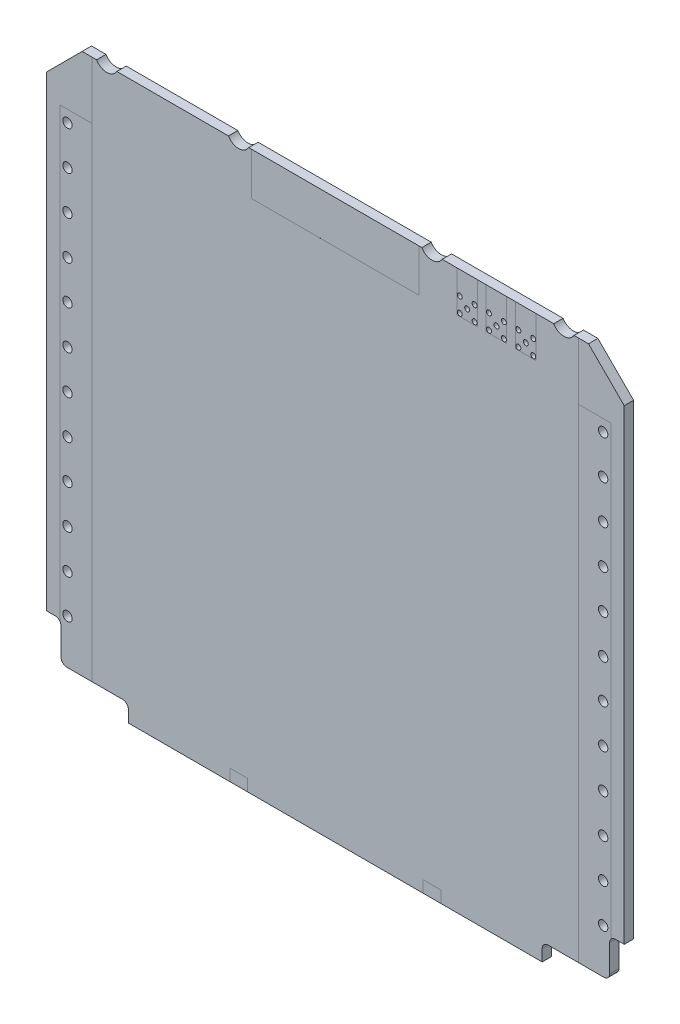
from build123d import *

# Parameters (mm, degrees)
SKETCH1_W                            = 98.6
SKETCH1_H                            = 95.3
BASICSIZE_DEPTH                      = 1.6
CHAMFER1_SIZE                        = 6.1
BACKPLANESIDESCREWCUTOUT_DEPTH       = 71.235674696
LPATTERN3_COUNT                      = 2
LPATTERN3_PITCH                      = 22.5
MIRROR3_COPY_1_DEPTH                 = 71.235674696
MIRROR3_COPY_2_DEPTH                 = 71.235674696
CUT_EXTRUDE4_DEPTH                   = 71.235674696
FILLET1_R                            = 1
FILLET1_OF_MIRROR1_R                 = 1
SKETCH5_R                            = 0.425
CUT_EXTRUDE3_DEPTH                   = 71.235674696
LPATTERN2_COUNT                      = 3
LPATTERN2_PITCH                      = 5
PARTFOOTPRINTS_W                     = 3.5
PARTFOOTPRINTS_H                     = 6.95
MMCXFOOTPRINT_DEPTH                  = 0.0001
SKETCH7_W                            = 28.575
SKETCH7_H                            = 7.293
TIGEREYEFOOTPRINT_DEPTH              = 0.0001
KEEPOUT_BOTTOM_DEPTH                 = 0.0001
CAUTION_TOP_START                    = -0.00015
CAUTION_TOP_DEPTH                    = 0.00015
HOLD_DOWNLOCATIONS_W                 = 3
HOLD_DOWNLOCATIONS_H                 = 2
HOLD_DOWNFOOTPRINTS_DEPTH            = 0.0001
CLEARANCES_SIDE_SIDE_COPY_1_DEPTH    = 0.0001
CLEARANCES_SIDE_SIDE_START           = -0.00015
CLEARANCES_SIDE_SIDE_COPY_2_DEPTH    = 0.00015
CLEARANCES_SIDE_SIDE_COPY_3_SKETCH_W = 3
CLEARANCES_SIDE_SIDE_COPY_3_SKETCH_H = 2
CLEARANCES_SIDE_SIDE_COPY_3_DEPTH    = 0.0001
CLEARANCES_SIDE_SIDE_COPY_4_DEPTH    = 0.0001
CLEARANCES_SIDE_SIDE_COPY_5_DEPTH    = 0.00015
CLEARANCES_SIDE_SIDE_COPY_6_SKETCH_W = 3
CLEARANCES_SIDE_SIDE_COPY_6_SKETCH_H = 2
CLEARANCES_SIDE_SIDE_COPY_6_DEPTH    = 0.0001
SKETCH8_R                            = 0.8
CUT_EXTRUDE5_DEPTH                   = 10


with BuildPart() as part:
    # Sketch1 → basicSize (new body)
    with BuildSketch(Plane(origin=(0, 0, -0.0125), x_dir=(-1, 0, 0), z_dir=(0, 0, -1))):
        with Locations((0, -2.35)):
            Rectangle(SKETCH1_W, SKETCH1_H)
    extrude(amount=-BASICSIZE_DEPTH)

    # Chamfer1
    chamfer1_edges = [part.edges().sort_by_distance(p)[0] for p in [
        (49.3, 45.3, 0.7875),
        (-49.3, 45.3, 0.7875),
    ]]
    chamfer(chamfer1_edges, length=CHAMFER1_SIZE)

    # Sketch4 → backplaneSideScrewCutout (cut, symmetric)
    with BuildSketch(Plane.XY.offset(1.5875)):
        with BuildLine():
            Line((37.267949192, 45.3), (40.732050808, 45.3))
            ThreePointArc((40.732050808, 45.3), (39, 44.3), (37.267949192, 45.3))
        make_face()
    backplanesidescrewcutout = extrude(amount=BACKPLANESIDESCREWCUTOUT_DEPTH, both=True, mode=Mode.SUBTRACT)

    # LPattern3: backplaneSideScrewCutout ×2
    with Locations(*[(-i * LPATTERN3_PITCH, 0, 0) for i in range(1, LPATTERN3_COUNT)]):
        add(backplanesidescrewcutout, mode=Mode.SUBTRACT)

    # Mirror3 copy 1 sketch → Mirror3 copy 1 (cut, symmetric)
    with BuildSketch(Plane(origin=(22.5, 0, 1.5875), x_dir=(-1, 0, 0), z_dir=(0, 0, 1))):
        with BuildLine():
            Line((37.267949192, -45.3), (40.732050808, -45.3))
            ThreePointArc((40.732050808, -45.3), (39, -44.3), (37.267949192, -45.3))
        make_face()
    extrude(amount=MIRROR3_COPY_1_DEPTH, both=True, mode=Mode.SUBTRACT)

    # Mirror3 copy 2 sketch → Mirror3 copy 2 (cut, symmetric)
    with BuildSketch(Plane(origin=(0, 0, 1.5875), x_dir=(-1, 0, 0), z_dir=(0, 0, 1))):
        with BuildLine():
            Line((37.267949192, -45.3), (40.732050808, -45.3))
            ThreePointArc((40.732050808, -45.3), (39, -44.3), (37.267949192, -45.3))
        make_face()
    extrude(amount=MIRROR3_COPY_2_DEPTH, both=True, mode=Mode.SUBTRACT)

    # Sketch6 → Cut-Extrude4 (cut, through all)
    with BuildSketch(Plane.XY.offset(1.5875)):
        Polygon((-49.3, -40.4), (-46.8, -40.4), (-46.8, -47), (-35.3, -47), (-35.3, -50), (-49.3, -50), align=None)
    cut_extrude4 = extrude(amount=-CUT_EXTRUDE4_DEPTH, mode=Mode.SUBTRACT)

    # Fillet1
    fillet1_edges = [part.edges().sort_by_distance(p)[0] for p in [
        (-35.3, -47, 0.7875),
        (-46.8, -47, 0.7875),
        (-46.8, -40.4, 0.7875),
    ]]
    fillet(fillet1_edges, radius=FILLET1_R)

    # Mirror1: Cut-Extrude4 across plane
    add(cut_extrude4.mirror(Plane(origin=(0, 0, 0), x_dir=(0, 0, 1), z_dir=(1, 0, 0))), mode=Mode.SUBTRACT)

    # Fillet1 of Mirror1
    fillet1_of_mirror1_edges = [part.edges().sort_by_distance(p)[0] for p in [
        (35.3, -47, 0.7875),
        (46.8, -47, 0.7875),
        (46.8, -40.4, 0.7875),
    ]]
    fillet(fillet1_of_mirror1_edges, radius=FILLET1_OF_MIRROR1_R)

    # Sketch5 → Cut-Extrude3 (cut, through all)
    with BuildSketch(Plane.XY.offset(1.5875)):
        with Locations((22.5, 40.1)):
            Circle(SKETCH5_R)
        with Locations((21.23, 41.37)):
            Circle(SKETCH5_R)
        with Locations((21.23, 38.83)):
            Circle(SKETCH5_R)
        with Locations((23.77, 41.37)):
            Circle(SKETCH5_R)
        with Locations((23.77, 38.83)):
            Circle(SKETCH5_R)
    cut_extrude3 = extrude(amount=-CUT_EXTRUDE3_DEPTH, mode=Mode.SUBTRACT)

    # LPattern2: Cut-Extrude3 ×3
    with Locations(*[(i * LPATTERN2_PITCH, 0, 0) for i in range(1, LPATTERN2_COUNT)]):
        add(cut_extrude3, mode=Mode.SUBTRACT)

    # partFootprints → MMCXfootprint (cut)
    with BuildSketch(Plane.XY.offset(1.5875)):
        with Locations((22.5, 41.825)):
            Rectangle(PARTFOOTPRINTS_W, PARTFOOTPRINTS_H)
        with Locations((27.5, 41.825)):
            Rectangle(PARTFOOTPRINTS_W, PARTFOOTPRINTS_H)
        with Locations((32.5, 41.825)):
            Rectangle(PARTFOOTPRINTS_W, PARTFOOTPRINTS_H)
    extrude(amount=-MMCXFOOTPRINT_DEPTH, mode=Mode.SUBTRACT)

    # Sketch7 → TigerEyeFootprint (cut)
    with BuildSketch(Plane.XY.offset(1.5875)):
        with Locations((0, 41.6535)):
            Rectangle(SKETCH7_W, SKETCH7_H)
    extrude(amount=-TIGEREYEFOOTPRINT_DEPTH, mode=Mode.SUBTRACT)

    # thermalContacts_upper → keepOut_bottom (cut)
    with BuildSketch(Plane.XY.offset(1.5875)):
        Polygon((-47, 35.5), (-47, -41.5), (-56.192158269, -41.5), (-56.192158269, 47), (-41.5, 47), (-41.5, 35.5), align=None)
    keepout_bottom = extrude(amount=-KEEPOUT_BOTTOM_DEPTH, mode=Mode.SUBTRACT)

    # Sketch3 → caution_top (cut)
    with BuildSketch(Plane.XY.offset(1.5875).offset(CAUTION_TOP_START)):
        with BuildLine():
            Line((-41.5, 35.5), (-47, 35.5))
            Line((-47, 35.5), (-47, -40.8))
            ThreePointArc((-47, -40.8), (-46.851316702, -41.083772234), (-46.8, -41.4))
            Line((-46.8, -41.4), (-46.8, -46))
            ThreePointArc((-46.8, -46), (-46.507106781, -46.707106781), (-45.8, -47))
            Line((-45.8, -47), (-41.5, -47))
            Line((-41.5, -47), (-41.5, 35.5))
        make_face()
    caution_top = extrude(amount=CAUTION_TOP_DEPTH, mode=Mode.SUBTRACT)

    # hold-downLocations → hold-downFootprints (cut)
    with BuildSketch(Plane.XY.offset(1.5875)):
        with Locations((16.5, -49)):
            Rectangle(HOLD_DOWNLOCATIONS_W, HOLD_DOWNLOCATIONS_H)
    hold_downfootprints = extrude(amount=-HOLD_DOWNFOOTPRINTS_DEPTH, mode=Mode.SUBTRACT)

    # clearances_top-bottom: keepOut_bottom, caution_top, hold-downFootprints across plane
    add(keepout_bottom.mirror(Plane.XY.offset(0.7875)), mode=Mode.SUBTRACT)
    add(caution_top.mirror(Plane.XY.offset(0.7875)), mode=Mode.SUBTRACT)
    add(hold_downfootprints.mirror(Plane.XY.offset(0.7875)), mode=Mode.SUBTRACT)

    # clearances_side-side copy 1 sketch → clearances_side-side copy 1 (cut)
    with BuildSketch(Plane(origin=(0, 0, -0.0125), x_dir=(-1, 0, 0), z_dir=(0, 0, -1))):
        Polygon((-47, 35.5), (-47, -41.5), (-56.192158269, -41.5), (-56.192158269, 47), (-41.5, 47), (-41.5, 35.5), align=None)
    extrude(amount=-CLEARANCES_SIDE_SIDE_COPY_1_DEPTH, mode=Mode.SUBTRACT)

    # clearances_side-side copy 2 sketch → clearances_side-side copy 2 (cut)
    with BuildSketch(Plane(origin=(0, 0, -0.0125), x_dir=(-1, 0, 0), z_dir=(0, 0, -1)).offset(CLEARANCES_SIDE_SIDE_START)):
        with BuildLine():
            Line((-41.5, 35.5), (-47, 35.5))
            Line((-47, 35.5), (-47, -40.8))
            ThreePointArc((-47, -40.8), (-46.851316702, -41.083772234), (-46.8, -41.4))
            Line((-46.8, -41.4), (-46.8, -46))
            ThreePointArc((-46.8, -46), (-46.507106781, -46.707106781), (-45.8, -47))
            Line((-45.8, -47), (-41.5, -47))
            Line((-41.5, -47), (-41.5, 35.5))
        make_face()
    extrude(amount=CLEARANCES_SIDE_SIDE_COPY_2_DEPTH, mode=Mode.SUBTRACT)

    # clearances_side-side copy 3 sketch → clearances_side-side copy 3 (cut)
    with BuildSketch(Plane(origin=(0, 0, -0.0125), x_dir=(-1, 0, 0), z_dir=(0, 0, -1))):
        with Locations((16.5, -49)):
            Rectangle(CLEARANCES_SIDE_SIDE_COPY_3_SKETCH_W, CLEARANCES_SIDE_SIDE_COPY_3_SKETCH_H)
    extrude(amount=-CLEARANCES_SIDE_SIDE_COPY_3_DEPTH, mode=Mode.SUBTRACT)

    # clearances_side-side copy 4 sketch → clearances_side-side copy 4 (cut)
    with BuildSketch(Plane(origin=(0, 0, 1.5875), x_dir=(-1, 0, 0), z_dir=(0, 0, 1))):
        Polygon((-47, -35.5), (-47, 41.5), (-56.192158269, 41.5), (-56.192158269, -47), (-41.5, -47), (-41.5, -35.5), align=None)
    extrude(amount=-CLEARANCES_SIDE_SIDE_COPY_4_DEPTH, mode=Mode.SUBTRACT)

    # clearances_side-side copy 5 sketch → clearances_side-side copy 5 (cut)
    with BuildSketch(Plane(origin=(0, 0, 1.5875), x_dir=(-1, 0, 0), z_dir=(0, 0, 1)).offset(CLEARANCES_SIDE_SIDE_START)):
        with BuildLine():
            Line((-41.5, -35.5), (-47, -35.5))
            Line((-47, -35.5), (-47, 40.8))
            ThreePointArc((-47, 40.8), (-46.851316702, 41.083772234), (-46.8, 41.4))
            Line((-46.8, 41.4), (-46.8, 46))
            ThreePointArc((-46.8, 46), (-46.507106781, 46.707106781), (-45.8, 47))
            Line((-45.8, 47), (-41.5, 47))
            Line((-41.5, 47), (-41.5, -35.5))
        make_face()
    extrude(amount=CLEARANCES_SIDE_SIDE_COPY_5_DEPTH, mode=Mode.SUBTRACT)

    # clearances_side-side copy 6 sketch → clearances_side-side copy 6 (cut)
    with BuildSketch(Plane(origin=(0, 0, 1.5875), x_dir=(-1, 0, 0), z_dir=(0, 0, 1))):
        with Locations((16.5, 49)):
            Rectangle(CLEARANCES_SIDE_SIDE_COPY_6_SKETCH_W, CLEARANCES_SIDE_SIDE_COPY_6_SKETCH_H)
    extrude(amount=-CLEARANCES_SIDE_SIDE_COPY_6_DEPTH, mode=Mode.SUBTRACT)

    # Sketch8 → Cut-Extrude5 (cut)
    with BuildSketch(Plane.XY.offset(1.5875)):
        with Locations((-45.7, 33.5)):
            Circle(SKETCH8_R)
        with Locations((-45.7, 26.872727273)):
            Circle(SKETCH8_R)
        with Locations((-45.7, 20.245454545)):
            Circle(SKETCH8_R)
        with Locations((-45.7, 13.618181818)):
            Circle(SKETCH8_R)
        with Locations((-45.7, 6.990909091)):
            Circle(SKETCH8_R)
        with Locations((-45.7, 0.363636364)):
            Circle(SKETCH8_R)
        with Locations((-45.7, -6.263636364)):
            Circle(SKETCH8_R)
        with Locations((-45.7, -12.890909091)):
            Circle(SKETCH8_R)
        with Locations((-45.7, -19.518181818)):
            Circle(SKETCH8_R)
        with Locations((-45.7, -26.145454545)):
            Circle(SKETCH8_R)
        with Locations((-45.7, -32.772727273)):
            Circle(SKETCH8_R)
        with Locations((-45.7, -39.4)):
            Circle(SKETCH8_R)
    cut_extrude5 = extrude(amount=-CUT_EXTRUDE5_DEPTH, mode=Mode.SUBTRACT)

    # Mirror4: Cut-Extrude5 across plane
    add(cut_extrude5.mirror(Plane(origin=(0, 0, 0), x_dir=(0, 0, 1), z_dir=(1, 0, 0))), mode=Mode.SUBTRACT)


solid = part.part
